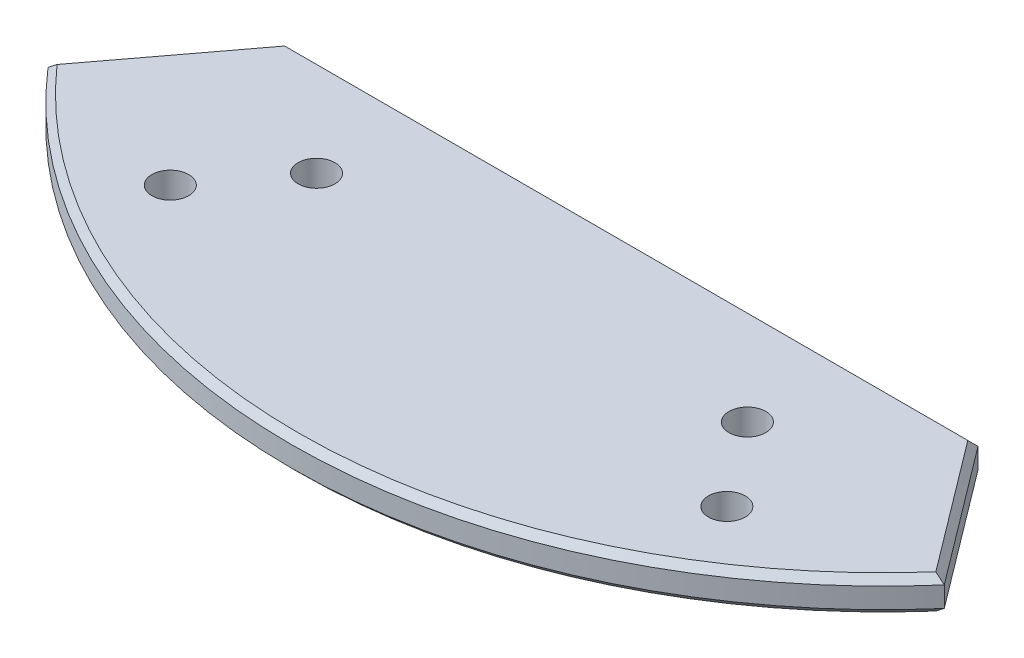
from build123d import *

# Parameters (mm, degrees)
SKETCH1_R           = 3.25
BOSS_EXTRUDE1_DEPTH = 6
SKETCH2_R           = 4
CUT_EXTRUDE1_DEPTH  = 4
CHAMFER1_START      = -18.742104721
CHAMFER1_2_DEPTH    = 45.742104721
CHAMFER1_START_2    = -27
CHAMFER1_3_DEPTH    = 45.742104721
CHAMFER2_SIZE       = 1.2


with BuildPart() as part:
    # Sketch1 → Boss-Extrude1 (new body)
    with BuildSketch(Plane(origin=(0, 36, 0), x_dir=(1, 0, 0), z_dir=(0, 1, 0))):
        with BuildLine():
            Line((-60.898028106, -44.25832974), (60.898028106, -44.25832974))
            Line((60.898028106, -44.25832974), (79.111739679, -68.428741366))
            ThreePointArc((79.111739679, -68.428741366), (0, -104.6), (-79.111739679, -68.428741366))
            Line((-79.111739679, -68.428741366), (-60.898028106, -44.25832974))
        make_face()
        with Locations(Location((38.031910385, -62.101530721, 0), (0, 0, 270))):
            Circle(SKETCH1_R, mode=Mode.SUBTRACT)
        with Locations(Location((49.125752403, -76.823556322, 0), (0, 0, 270))):
            Circle(SKETCH1_R, mode=Mode.SUBTRACT)
        with Locations(Location((-49.125752403, -76.823556322, 0), (0, 0, 90))):
            Circle(SKETCH1_R, mode=Mode.SUBTRACT)
        with Locations(Location((-38.031910385, -62.101530721, 0), (0, 0, 90))):
            Circle(SKETCH1_R, mode=Mode.SUBTRACT)
    extrude(amount=BOSS_EXTRUDE1_DEPTH)

    # Sketch2 → Cut-Extrude1 (cut)
    with BuildSketch(Plane.XZ.offset(-36)):
        with Locations(Location((0, 91.29880712, 0), (0, 0, 270))):
            Circle(SKETCH2_R)
        with Locations(Location((0, 67.77856843, 0), (0, 0, 270))):
            Circle(SKETCH2_R)
        with Locations((0, 44.25832974)):
            Circle(SKETCH2_R)
    extrude(amount=-CUT_EXTRUDE1_DEPTH, mode=Mode.SUBTRACT)

    # Chamfer1: read off the stored shape, not the designer's step
    # Chamfer1 outline → Chamfer1 (revolve, cut)
    with BuildSketch(Plane.XY):
        Polygon((104.6, 37.2), (103.4, 36), (104.6, 36), align=None)
    revolve(axis=Axis((0, 0, 0), (0, 1, 0)), mode=Mode.SUBTRACT)

    # Chamfer1 2 outline → Chamfer1 2 (cut)
    with BuildSketch(Plane(origin=(0, 0, 0), x_dir=(0.9431059319759283, 0.23510763606464977, -0.23510763606464977), z_dir=(0.3324924075401055, -0.6668765998774377, 0.6668765998774377)).offset(CHAMFER1_START)):
        Polygon((46, 57.599737343), (-59.092758772, 57.599737343), (-81.95286654, 74.690799308), (-83, 75.473675007), (-83, 56), (46, 56), align=None)
    extrude(amount=CHAMFER1_2_DEPTH, mode=Mode.SUBTRACT)

    # Chamfer1 3 outline → Chamfer1 3 (cut)
    with BuildSketch(Plane(origin=(0, 0, 0), x_dir=(0.9431059319759302, -0.23510763606464624, 0.23510763606464624), z_dir=(0.33249240754010045, 0.6668765998774391, -0.6668765998774391)).offset(CHAMFER1_START_2)):
        Polygon((-45, -57.599737343), (59.092758772, -57.599737343), (81.95286654, -74.690799308), (83, -75.473675007), (83, -56), (-45, -56), align=None)
    extrude(amount=CHAMFER1_3_DEPTH, mode=Mode.SUBTRACT)

    # Chamfer2
    chamfer2_edges = [part.edges().sort_by_distance(p)[0] for p in [
        (70.004883892, 42, 56.343535553),
        (0, 42, 44.25832974),
        (-70.004883892, 42, 56.343535553),
        (0, 42, 104.6),
    ]]
    chamfer(chamfer2_edges, length=CHAMFER2_SIZE)


solid = part.part
